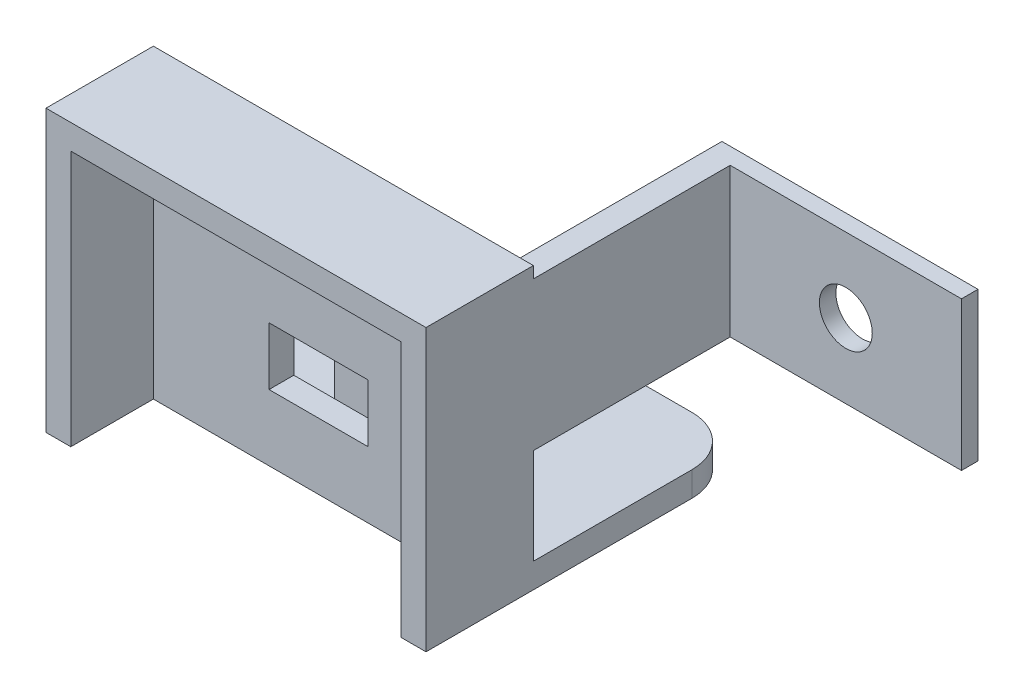
from build123d import *

# Parameters (mm, degrees)
SKETCH_1_W             = 23
SKETCH_1_H             = 17
EXTRUDE_1_DEPTH        = 6.5
SKETCH_2_W             = 20
SKETCH_2_H             = 15.5
CUT_EXTRUDE_1_DEPTH    = 5
SKETCH_3_W             = 23
SKETCH_3_H             = 1.5
EXTRUDE_2_DEPTH        = 12.6
FILLET_1_R             = 3
EXTRUDE_3_DEPTH        = 3
HOLE_WIZARD_M3_1_D     = 3.2
EXTRUDE_START          = -11.5
EXTRUDE_6_DEPTH        = 1.5
CUT_EXTRUDE_2534_REACH = 21.059
SKETCH_10_W            = 6
SKETCH_10_H            = 3.5
SKETCH_11_W            = 1.5
SKETCH_11_H            = 9
EXTRUDE_10_DEPTH       = 12.910593501
SKETCH_12_W            = 1
SKETCH_12_H            = 9
EXTRUDE_11_DEPTH       = 14
HOLE_WIZARD_M3_2_D     = 3.2


# Read off the part's stored shape, not the designer's step: 凸台-拉伸6
with BuildPart() as part:
    # 草图1 → 凸台-拉伸1 (new body)
    with BuildSketch(Plane.XY):
        Rectangle(SKETCH_1_W, SKETCH_1_H)
    extrude(amount=EXTRUDE_1_DEPTH)

    # 草图2 → 切除-拉伸1 (cut)
    with BuildSketch(Plane.XY.offset(6.5)):
        with Locations((0, -0.75)):
            Rectangle(SKETCH_2_W, SKETCH_2_H)
    extrude(amount=-CUT_EXTRUDE_1_DEPTH, mode=Mode.SUBTRACT)

    # 草图3 → 凸台-拉伸2 (add)
    with BuildSketch(Plane(origin=(0, 0, 0), x_dir=(-1, 0, 0), z_dir=(0, 0, -1))):
        with Locations((0, -7.75)):
            Rectangle(SKETCH_3_W, SKETCH_3_H)
    extrude(amount=EXTRUDE_2_DEPTH)

    # 圆角1
    fillet_1_edges = [part.edges().sort_by_distance(p)[0] for p in [
        (11.5, -7.75, -12.6),
        (-11.5, -7.75, -12.6),
    ]]
    fillet(fillet_1_edges, radius=FILLET_1_R)

    # 草图4 → 凸台-拉伸3 (add)
    with BuildSketch(Plane(origin=(0, -7, 0), x_dir=(1, 0, 0), z_dir=(0, 1, 0))):
        Polygon((5.080682369, 6.4), (2.540341184, 10.8), (-2.540341184, 10.8), (-5.080682369, 6.4), (-2.540341184, 2), (2.540341184, 2), align=None)
        Polygon((3.348631561, 6.4), (1.674315781, 9.3), (-1.674315781, 9.3), (-3.348631561, 6.4), (-1.674315781, 3.5), (1.674315781, 3.5), align=None, mode=Mode.SUBTRACT)
    extrude(amount=EXTRUDE_3_DEPTH)

    # M3 间隙孔1 (through all)
    with Locations(Plane(origin=(0, -7, 0), x_dir=(1, 0, 0), z_dir=(0, 1, 0))):
        with Locations((0, 6.4)):
            Hole(HOLE_WIZARD_M3_1_D / 2)

    # 凸台-拉伸6 outline → 凸台-拉伸6 (add)
    with BuildSketch(Plane.YZ.offset(EXTRUDE_START)):
        Polygon((-7, 0), (-7, -10.266991259), (3.266991259, 0), align=None)
    extrude(amount=EXTRUDE_6_DEPTH)

    # 草图10 → Cut-Extrude 2534 (cut, up to next)
    with BuildSketch(Plane(origin=(0, 0, 0), x_dir=(-1, 0, 0), z_dir=(0, 0, -1)), mode=Mode.PRIVATE) as cut_extrude_2534_sk1:
        with Locations((0, -2.75)):
            Rectangle(SKETCH_10_W, SKETCH_10_H)
    cut_extrude_2534_tool1 = extrude(cut_extrude_2534_sk1.sketch, amount=-CUT_EXTRUDE_2534_REACH, mode=Mode.PRIVATE) & part.part
    add(cut_extrude_2534_tool1.solids().sort_by_distance((0, -2.75, 0))[0], mode=Mode.SUBTRACT)

    # 草图11 → 凸台-拉伸10 (add)
    with BuildSketch(Plane(origin=(0, 0, 0), x_dir=(-1, 0, 0), z_dir=(0, 0, -1))):
        with Locations((-10.75, 3.3)):
            Rectangle(SKETCH_11_W, SKETCH_11_H)
    extrude(amount=EXTRUDE_10_DEPTH)

    # 草图12 → 凸台-拉伸11 (add)
    with BuildSketch(Plane(origin=(11.5, 0, 0), x_dir=(0, 0, -1), z_dir=(1, 0, 0))):
        with Locations((12.410593501, 3.3)):
            Rectangle(SKETCH_12_W, SKETCH_12_H)
    extrude(amount=EXTRUDE_11_DEPTH)

    # M3 间隙孔2 (through all)
    with Locations(Plane.XY.offset(-11.910593501)):
        with Locations((18.5, 3.3)):
            Hole(HOLE_WIZARD_M3_2_D / 2)


solid = part.part
